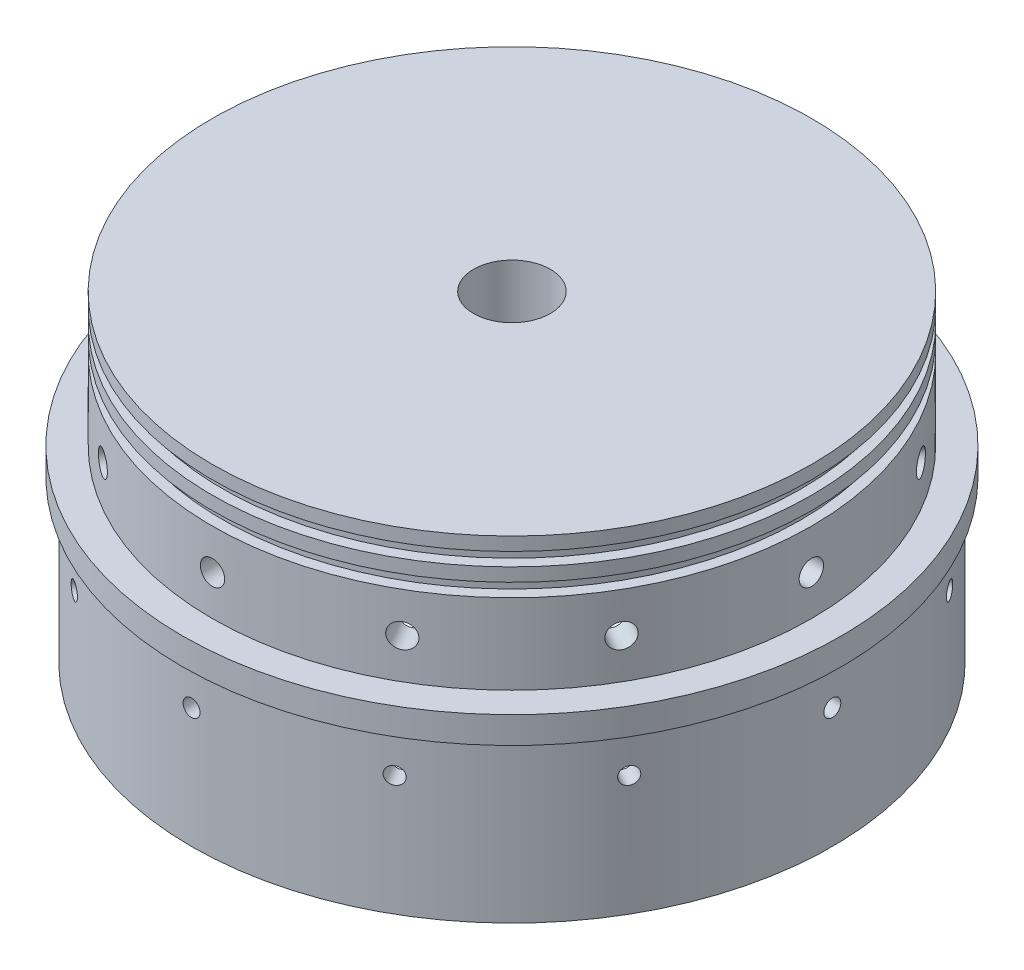
from build123d import *

# Parameters (mm, degrees)
SKETCH1_R                    = 78.359
CENTERRING_TOTOD_THK_DEPTH   = 6.35
SKETCH2_R                    = 71.247
TANKRING_TANKID_HT_DEPTH     = 31.75
SKETCH3_R                    = 76.2
FBRGLSRING_FBRGLSID_HT_DEPTH = 38.1
SKETCH4_R                    = 65.0875
WALL_BLKHDTHK_DEPTH          = 60.325
SKETCH5_W                    = 2.54
SKETCH5_H                    = 3.175
SKETCH6_R                    = 2.8956
TANKBOLTHOLE_DEPTH           = 118.183086501
TANKBOLTCOUNT_COUNT          = 12
SKETCH7_R                    = 2.0193
FBRGLSBOLTHOLE_DEPTH         = 118.183086534
FBRGLSBOLTCOUNT_COUNT        = 12
SKETCH8_R                    = 9.128125
F_1_2NPTFEMDRILL_DEPTH       = 135.486823805
SMOOTHING_R                  = 12.7
SKETCH9_R                    = 71.4375
FBRGLSRINGTRIM_DEPTH         = 38.1
TRIMSMOOTING_R               = 6.35


# Some blends are built 0.0001 mm under size
with BuildPart() as part:
    # Sketch1 → CenterRing(TotOD&Thk) (new body)
    with BuildSketch(Plane(origin=(0, 0, 0), x_dir=(1, 0, 0), z_dir=(0, 1, 0))):
        with Locations(Location((0, 0, 0), (0, 0, 270))):
            Circle(SKETCH1_R)
    extrude(amount=CENTERRING_TOTOD_THK_DEPTH)

    # Sketch2 → TankRing(TankID&Ht) (add)
    with BuildSketch(Plane(origin=(0, 6.35, 0), x_dir=(1, 0, 0), z_dir=(0, 1, 0))):
        with Locations(Location((0, 0, 0), (0, 0, 270))):
            Circle(SKETCH2_R)
    extrude(amount=TANKRING_TANKID_HT_DEPTH)

    # Sketch3 → FbrGlsRing(FbrGlsID&Ht) (add)
    with BuildSketch(Plane.XZ):
        with Locations(Location((0, 0, 0), (0, 0, 90))):
            Circle(SKETCH3_R)
    extrude(amount=FBRGLSRING_FBRGLSID_HT_DEPTH)

    # Sketch4 → Wall&BlkhdThk (cut)
    with BuildSketch(Plane.XZ.offset(38.1)):
        with Locations(Location((0, 0, 0), (0, 0, 270))):
            Circle(SKETCH4_R)
    extrude(amount=-WALL_BLKHDTHK_DEPTH, mode=Mode.SUBTRACT)

    # Sketch5 → O-Ring Channel (revolve, cut)
    with BuildSketch(Plane.XY, mode=Mode.PRIVATE) as o_ring_channel_sk:
        with Locations((-69.977, 33.3375)):
            Rectangle(SKETCH5_W, SKETCH5_H)
        with Locations((-69.977, 26.9875)):
            Rectangle(SKETCH5_W, SKETCH5_H)
    revolve(o_ring_channel_sk.sketch.rotate(Axis((0, 6.35, 0), (0, 1, 0)), 180), axis=Axis((0, 6.35, 0), (0, 1, 0)), mode=Mode.SUBTRACT)

    # Sketch6 → TankBoltHole (cut, through all)
    with BuildSketch(Plane.XY):
        with Locations(Location((0, 15.875, 0), (0, 0, 90))):
            Circle(SKETCH6_R)
    tankbolthole = extrude(amount=-TANKBOLTHOLE_DEPTH, mode=Mode.SUBTRACT)

    # TankBoltCount: TankBoltHole ×12 about axis
    tankboltcount_axis = Axis((0, 38.1, 0), (0, -1, 0))
    for i in range(1, TANKBOLTCOUNT_COUNT):
        add(tankbolthole.rotate(tankboltcount_axis, i * 360 / TANKBOLTCOUNT_COUNT), mode=Mode.SUBTRACT)

    # Sketch7 → FbrGlsBoltHole (cut, through all)
    with BuildSketch(Plane.XY):
        with Locations(Location((0, -9.525, 0), (0, 0, 90))):
            Circle(SKETCH7_R)
    fbrglsbolthole = extrude(amount=-FBRGLSBOLTHOLE_DEPTH, mode=Mode.SUBTRACT)

    # FbrGlsBoltCount: FbrGlsBoltHole ×12 about axis
    fbrglsboltcount_axis = Axis((0, -38.1, 0), (0, 1, 0))
    for i in range(1, FBRGLSBOLTCOUNT_COUNT):
        add(fbrglsbolthole.rotate(fbrglsboltcount_axis, i * 360 / FBRGLSBOLTCOUNT_COUNT), mode=Mode.SUBTRACT)

    # Sketch8 → 1/2NPTFemDrill (cut, through all)
    with BuildSketch(Plane(origin=(0, 38.1, 0), x_dir=(1, 0, 0), z_dir=(0, 1, 0))):
        with Locations(Location((0, 0, 0), (0, 0, 270))):
            Circle(SKETCH8_R)
    extrude(amount=-F_1_2NPTFEMDRILL_DEPTH, mode=Mode.SUBTRACT)

    # Smoothing
    # the kernel refuses this fillet: 12.7 mm, written as the material it adds along each edge
    with BuildSketch(Plane(origin=(0, 22.225, 0), x_dir=(0, 0, -1), z_dir=(-1, 0, 0))) as smoothing_piece_1_section:
        with BuildLine():
            CenterArc((65.0875 - SMOOTHING_R, SMOOTHING_R), SMOOTHING_R, 270, 90)
            Line((65.0875 - SMOOTHING_R, 0), (65.0875, 0))
            Line((65.0875, 0), (65.0875, SMOOTHING_R))
        make_face()
    smoothing_piece_1 = revolve(axis=Axis((0, 22.225, 0), (0, -1, 0)), mode=Mode.PRIVATE)
    smoothing_piece_1 = smoothing_piece_1 - Plane(origin=(0, 15.875, -32.447600212), x_dir=(0, 1, 0), z_dir=(0, 0, -1)) * Cylinder(2.8956, 261, mode=Mode.PRIVATE)
    smoothing_piece_1 = smoothing_piece_1 - Plane(origin=(0, 15.875, 0), x_dir=(0, 1, 0), z_dir=(-0.49999999999999994, 0, -0.8660254037844388)) * Cylinder(2.8956, 261, mode=Mode.PRIVATE)
    smoothing_piece_1 = smoothing_piece_1 - Plane(origin=(28.100446075, 15.875, 16.223800106), x_dir=(0, 1, 0), z_dir=(-0.8660254037844388, 0, -0.49999999999999983)) * Cylinder(2.8956, 261, mode=Mode.PRIVATE)
    smoothing_piece_1 = smoothing_piece_1 - Plane(origin=(56.200892151, 15.875, 0), x_dir=(0, 1, 0), z_dir=(-1, 0, 0)) * Cylinder(2.8956, 261, mode=Mode.PRIVATE)
    smoothing_piece_1 = smoothing_piece_1 - Plane(origin=(56.200892151, 15.875, -32.447600212), x_dir=(0, 1, 0), z_dir=(-0.8660254037844386, 0, 0.5000000000000001)) * Cylinder(2.8956, 261, mode=Mode.PRIVATE)
    smoothing_piece_1 = smoothing_piece_1 - Plane(origin=(28.100446075, 15.875, -48.671400318), x_dir=(0, 1, 0), z_dir=(-0.49999999999999994, 0, 0.8660254037844387)) * Cylinder(2.8956, 261, mode=Mode.PRIVATE)
    add(smoothing_piece_1)

    # Sketch9 → FbrGlsRingTrim (cut)
    with BuildSketch(Plane.XZ.offset(38.1)):
        with Locations(Location((0, 0, 0), (0, 0, 270))):
            Circle(SKETCH9_R)
    extrude(amount=-FBRGLSRINGTRIM_DEPTH, mode=Mode.SUBTRACT)

    # TrimSmooting
    trimsmooting_edges = [part.edges().sort_by_distance(p)[0] for p in [
        (0, 0, 71.4375),
    ]]
    fillet(trimsmooting_edges, radius=TRIMSMOOTING_R - 0.0001)  # a hair under: the kernel refuses the full size


solid = part.part
